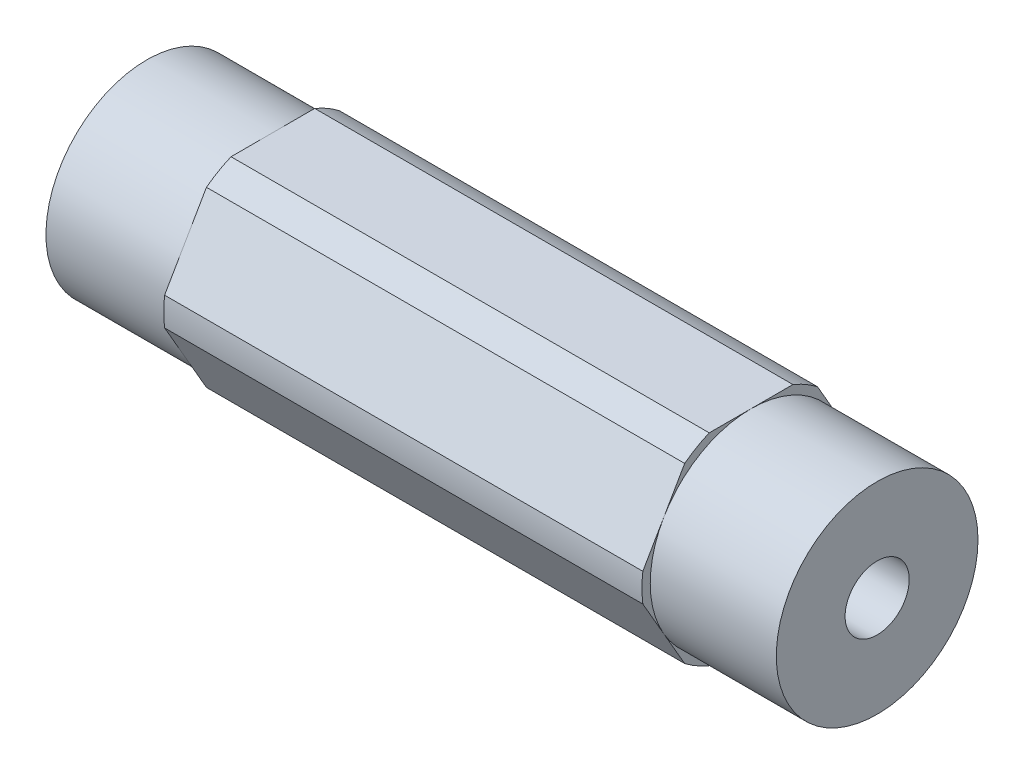
from build123d import *

# Parameters (mm, degrees)
SKETCH1_R               = 2.0193
BOSS_EXTRUDE1_DEPTH     = 22.99335
SKETCH3_R               = 8.89
SKETCH3_R_2             = 6.35
CUT_EXTRUDE_THIN1_DEPTH = 7.9375


with BuildPart() as part:
    # Sketch1 → Boss-Extrude1 (new, symmetric)
    with BuildSketch(Plane(origin=(0, 0, 0), x_dir=(0, 0, -1), z_dir=(1, 0, 0))):
        with BuildLine():
            ThreePointArc((4.181770846, 5.456960429), (3.437499983, 5.953924622), (2.634980936, 6.35))
            Line((2.634980936, 6.35), (-2.634980936, 6.35))
            ThreePointArc((-2.634980936, 6.35), (-3.437499983, 5.953924622), (-4.181770846, 5.456960429))
            Line((-4.181770846, 5.456960429), (-6.816751782, 0.893039571))
            ThreePointArc((-6.816751782, 0.893039571), (-6.874999966, 0), (-6.816751782, -0.893039571))
            Line((-6.816751782, -0.893039571), (-4.181770846, -5.456960429))
            ThreePointArc((-4.181770846, -5.456960429), (-3.437499983, -5.953924622), (-2.634980936, -6.35))
            Line((-2.634980936, -6.35), (2.634980936, -6.35))
            ThreePointArc((2.634980936, -6.35), (3.437499983, -5.953924622), (4.181770846, -5.456960429))
            Line((4.181770846, -5.456960429), (6.816751782, -0.893039571))
            ThreePointArc((6.816751782, -0.893039571), (6.860422465, -0.447468582), (6.874999966, 0))
            ThreePointArc((6.874999966, 0), (6.860422465, 0.447468582), (6.816751782, 0.893039571))
            Line((6.816751782, 0.893039571), (4.181770846, 5.456960429))
        make_face()
        Circle(SKETCH1_R, mode=Mode.SUBTRACT)
    extrude(amount=BOSS_EXTRUDE1_DEPTH, both=True)

    # Sketch3 → Cut-Extrude-Thin1 (cut)
    with BuildSketch(Plane(origin=(22.99335, 0, 0), x_dir=(0, 0, -1), z_dir=(1, 0, 0))):
        Circle(SKETCH3_R)
        Circle(SKETCH3_R_2, mode=Mode.SUBTRACT)
    cut_extrude_thin1 = extrude(amount=-CUT_EXTRUDE_THIN1_DEPTH, mode=Mode.SUBTRACT)

    # Mirror1: Cut-Extrude-Thin1 across plane
    add(cut_extrude_thin1.mirror(Plane(origin=(0, 0, 0), x_dir=(0, 0, 1), z_dir=(1, 0, 0))), mode=Mode.SUBTRACT)


solid = part.part
